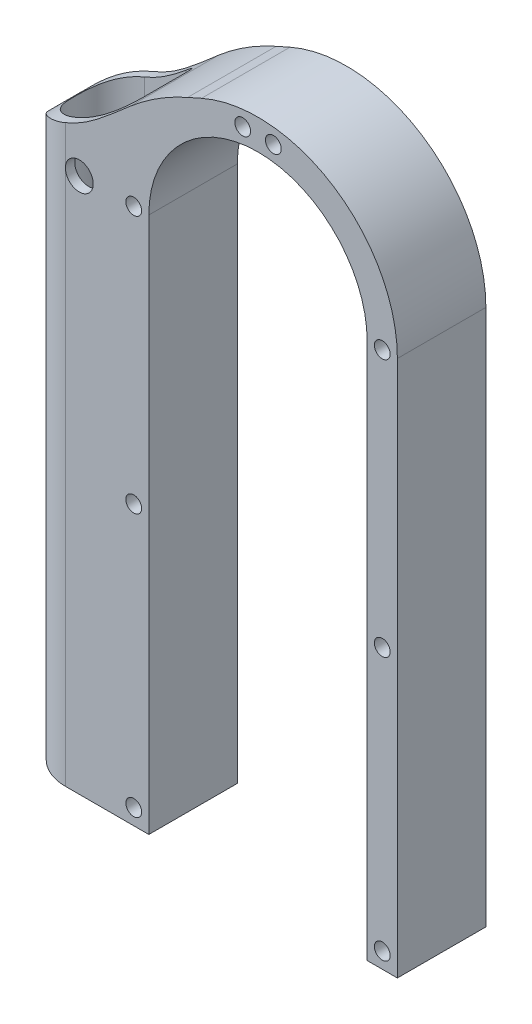
from build123d import *

# Parameters (mm, degrees)
BOSS_EXTRUDE1_DEPTH = 19.05
SKETCH2_R           = 1.7
CUT_EXTRUDE1_DEPTH  = 302.810637772
CUT_EXTRUDE2_DEPTH  = 302.810637772
BOSS_EXTRUDE2_DEPTH = 135
BOSS_EXTRUDE3_START = -19.05
BOSS_EXTRUDE3_DEPTH = 19.05
CUT_EXTRUDE4_DEPTH  = 316.043777756
CUT_EXTRUDE5_DEPTH  = 249.524391307
FILLET2_R           = 50
FILLET3_R           = 10
FILLET4_R           = 3
SKETCH8_R           = 3
CUT_EXTRUDE6_DEPTH  = 316.015975709


with BuildPart() as part:
    # Sketch1 → Boss-Extrude1 (new body)
    with BuildSketch(Plane.XY):
        with BuildLine():
            Line((-179.085368151, -18.789194183), (-179.085368151, 212.188334746))
            ThreePointArc((-179.085368151, 212.188334746), (-149.085368151, 242.188334746), (-119.085368151, 212.188334746))
            Line((-119.085368151, 212.188334746), (-119.085368151, -18.789194183))
            ThreePointArc((-119.085368151, -18.789194183), (-149.085368151, -48.789194183), (-179.085368151, -18.789194183))
        make_face()
        with BuildLine():
            Line((-172.585368151, -18.789194183), (-172.585368151, 212.188334746))
            ThreePointArc((-172.585368151, 212.188334746), (-149.085368151, 235.688334746), (-125.585368151, 212.188334746))
            Line((-125.585368151, 212.188334746), (-125.585368151, -18.789194183))
            ThreePointArc((-125.585368151, -18.789194183), (-149.085368151, -42.289194183), (-172.585368151, -18.789194183))
        make_face(mode=Mode.SUBTRACT)
    extrude(amount=BOSS_EXTRUDE1_DEPTH)

    # Sketch2 → Cut-Extrude1 (cut, through all)
    with BuildSketch(Plane.XY.offset(19.05)):
        with Locations((-145.785368151, 238.734002942)):
            Circle(SKETCH2_R)
        with Locations((-122.335368151, 212.188334746)):
            Circle(SKETCH2_R)
        with Locations((-152.485368151, -45.322239617)):
            Circle(SKETCH2_R)
        with Locations((-168.000474547, -37.70430058)):
            Circle(SKETCH2_R)
        with Locations((-175.835368151, -18.789194183)):
            Circle(SKETCH2_R)
        with Locations((-175.835368151, 212.188334746)):
            Circle(SKETCH2_R)
        with Locations((-145.685368151, -45.322239617)):
            Circle(SKETCH2_R)
        with Locations((-175.835368151, 100.099570281)):
            Circle(SKETCH2_R)
        with Locations((-175.835368151, 93.299570281)):
            Circle(SKETCH2_R)
        with Locations((-122.335368151, 100.099570281)):
            Circle(SKETCH2_R)
        with Locations((-122.335368151, 93.299570281)):
            Circle(SKETCH2_R)
        with Locations((-122.335368151, -18.789194183)):
            Circle(SKETCH2_R)
        with Locations((-130.170261754, -37.70430058)):
            Circle(SKETCH2_R)
        with Locations((-175.835368151, 156.699570281)):
            Circle(SKETCH2_R)
        with Locations((-122.335368151, 156.699570281)):
            Circle(SKETCH2_R)
        with Locations((-175.835368151, 66.699570281)):
            Circle(SKETCH2_R)
        with Locations((-122.335368151, 66.699570281)):
            Circle(SKETCH2_R)
        with Locations((-175.835368151, 36.699570281)):
            Circle(SKETCH2_R)
        with Locations((-122.335368151, 36.699570281)):
            Circle(SKETCH2_R)
        with Locations((-175.835368151, 6.699570281)):
            Circle(SKETCH2_R)
        with Locations((-122.335368151, 6.699570281)):
            Circle(SKETCH2_R)
        with Locations((-152.385368151, 238.734002942)):
            Circle(SKETCH2_R)
    extrude(amount=-CUT_EXTRUDE1_DEPTH, mode=Mode.SUBTRACT)

    # Sketch3 → Cut-Extrude2 (cut, through all)
    with BuildSketch(Plane.XY.offset(19.05)):
        Polygon((-149.085368151, 96.699570281), (-100.167336626, 96.699570281), (-100.167336626, -59.171887956), (-212.527814826, -59.171887956), (-212.527814826, 96.699570281), align=None)
    extrude(amount=-CUT_EXTRUDE2_DEPTH, mode=Mode.SUBTRACT)

    # Sketch4 → Boss-Extrude2 (add)
    with BuildSketch(Plane.XZ.offset(-96.699570281)):
        with BuildLine():
            Line((-179.085368151, 19.05), (-196.652205402, 19.05))
            ThreePointArc((-196.652205402, 19.05), (-200.585368151, 9.525), (-196.652205402, 0))
            Line((-196.652205402, 0), (-179.085368151, 0))
            Line((-179.085368151, 0), (-179.085368151, 19.05))
        make_face()
    extrude(amount=-BOSS_EXTRUDE2_DEPTH)

    # Sketch5 → Boss-Extrude3 (add)
    with BuildSketch(Plane.XY.offset(19.05).offset(BOSS_EXTRUDE3_START)):
        with BuildLine():
            Line((-179.085368151, 231.699570281), (-179.085368151, 212.188334746))
            ThreePointArc((-179.085368151, 212.188334746), (-174.234371945, 228.544605963), (-161.250194275, 239.611263206))
            Line((-161.250194275, 239.611263206), (-179.085368151, 231.699570281))
        make_face()
    extrude(amount=BOSS_EXTRUDE3_DEPTH)

    # Sketch6 → Cut-Extrude4 (cut, through all)
    with BuildSketch(Plane.XY.offset(19.05)):
        with BuildLine():
            Line((-170.167781213, 235.655416744), (-200.585368151, 235.655416744))
            Line((-200.585368151, 235.655416744), (-200.585368151, 214.140637656))
            add(Edge.make_bspline(
                [(-170.167781213, 235.655416744), (-176.900282948, 230.746544465), (-186.999558372, 219.576390382), (-197.475317375, 218.661877457), (-200.585368151, 214.140637656)],
                knots=[0, 0, 0, 0, 0.548460348, 1, 1, 1, 1], degree=3))
        make_face()
    extrude(amount=-CUT_EXTRUDE4_DEPTH, mode=Mode.SUBTRACT)

    # Sketch7 → Cut-Extrude5 (cut, through all)
    with BuildSketch(Plane.XZ.offset(-96.699570281)):
        with BuildLine():
            Line((-190.585368151, 17.025), (-178.585368151, 17.025))
            Line((-178.585368151, 17.025), (-178.585368151, 2.025))
            Line((-178.585368151, 2.025), (-190.585368151, 2.025))
            ThreePointArc((-190.585368151, 2.025), (-198.085368151, 9.525), (-190.585368151, 17.025))
        make_face()
    extrude(amount=-CUT_EXTRUDE5_DEPTH, mode=Mode.SUBTRACT)

    # Fillet2
    fillet2_edges = [part.edges().sort_by_distance(p)[0] for p in [
        (-170.167781213, 235.655416744, 9.525),
    ]]
    fillet(fillet2_edges, radius=FILLET2_R)

    # Fillet3
    # the kernel refuses this fillet: 10 mm, written as the material it takes off along each edge
    with BuildSketch(Plane(origin=(-196.652205402, 66.752998532, 0), x_dir=(1, 0, 0), z_dir=(0, 1, 0))) as fillet3_piece_1:
        with BuildLine():
            CenterArc((6.099219193, -10), FILLET3_R, 90, 97.799925588)
            ThreePointArc((-3.808260974, -11.357142857), (-3.23274377, -5.233062714), (0, 0))
            Line((0, 0), (6.099219193, 0))
        make_face()
    extrude(amount=180.922793438, mode=Mode.SUBTRACT)
    with BuildSketch(Plane(origin=(-196.652205402, 66.752998532, 19.05), x_dir=(-0.3179212804444137, 0, -0.9481171127242586), z_dir=(0, 1, 0))) as fillet3_piece_2:
        with BuildLine():
            CenterArc((7.542099552, -8.961986896), FILLET3_R, 63.66281519, 97.799925588)
            Line((-1.939071576, -5.782774091), (0, 0))
            ThreePointArc((0, 0), (5.98931435, 1.401317691), (11.9786287, 0))
        make_face()
    extrude(amount=180.922793438, mode=Mode.SUBTRACT)

    # Fillet4
    fillet4_edges = [part.edges().sort_by_distance(p)[0] for p in [
        (-178.585368151, 162.718537025, 17.025),
        (-178.585368151, 162.718537025, 2.025),
    ]]
    fillet(fillet4_edges, radius=FILLET4_R)

    # Sketch8 → Cut-Extrude6 (cut, through all)
    with BuildSketch(Plane(origin=(0, 0, 0), x_dir=(-1, 0, 0), z_dir=(0, 0, -1))):
        with Locations((187.552986209, 211.995977711)):
            Circle(SKETCH8_R)
    extrude(amount=-CUT_EXTRUDE6_DEPTH, mode=Mode.SUBTRACT)


solid = part.part
